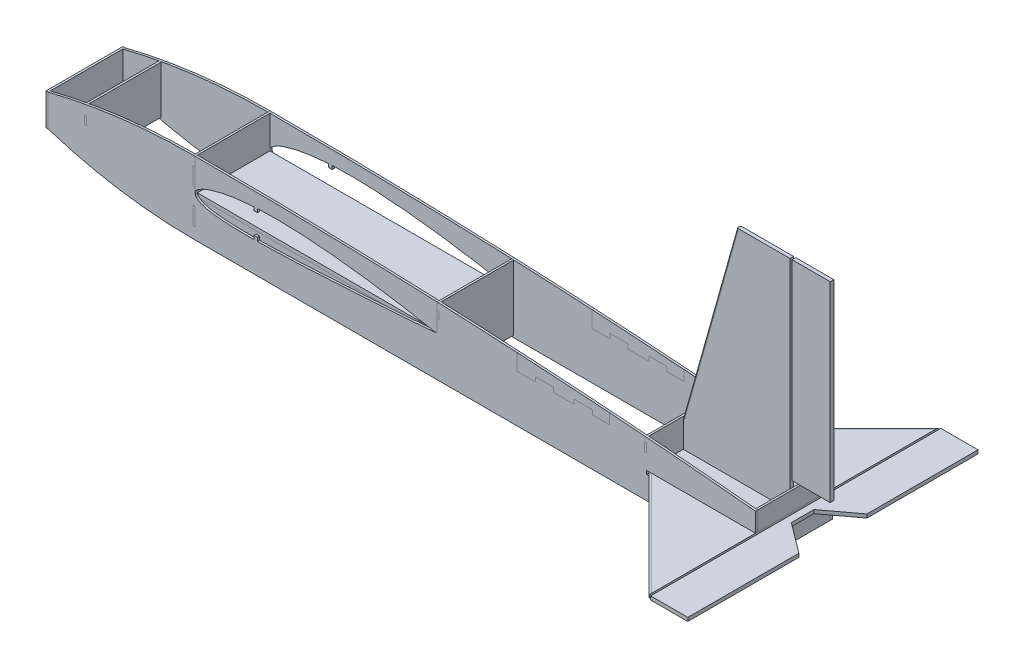
from build123d import *

# Parameters (mm, degrees)
BOSS_EXTRUDE4_DEPTH              = 3
BOSS_EXTRUDE5_DEPTH              = 3
BOSS_EXTRUDE6_DEPTH              = 2.8
BOSS_EXTRUDE7_DEPTH              = 2.8
BOSS_EXTRUDE8_DEPTH              = 2.8
SKETCH15_W                       = 101.6
SKETCH15_H                       = 63.5
BOSS_EXTRUDE9_DEPTH              = 2.8
BOSS_EXTRUDE10_DEPTH             = 3
CUT_EXTRUDE1_DEPTH               = 995.090061312
CUT_EXTRUDE1_DEPTH_BACK          = 995.090061312
SKETCH18_W                       = 152.4
SKETCH18_H                       = 5
SKETCH19_W                       = 149.6
SKETCH19_H                       = 11.952
BOSS_EXTRUDE12_DEPTH             = 10
BOSS_EXTRUDE12_2_DEPTH           = 10
BOSS_EXTRUDE13_DEPTH             = 5
SKETCH21_W                       = 139.7
SKETCH21_H                       = 12.7
BOSS_EXTRUDE14_DEPTH             = 10
BOSS_EXTRUDE14_2_DEPTH           = 10
CHAMFER1_SIZE                    = 76.2
CHAMFER1_SIZE2                   = 8.008942727
CHAMFER2_SIZE                    = 76.2
CHAMFER2_SIZE2                   = 8.008942727
CUT_EXTRUDE2_DEPTH               = 1013.71275419
CUT_EXTRUDE2_DEPTH_BACK          = 1013.71275419
SKETCH22_R                       = 1.27
SKETCH23_W                       = 406.4
SKETCH23_H                       = 5
BOSS_EXTRUDE15_DEPTH             = 52.07
CUT_EXTRUDE3_DEPTH               = 1067.751942393
CUT_EXTRUDE3_DEPTH_BACK          = 1067.751942393
SKETCH25_W                       = 127
SKETCH25_H                       = 5
BOSS_EXTRUDE16_REACH             = 1068.671
BOSS_EXTRUDE16_DIRECTION_2_REACH = 1068.671
BOSS_EXTRUDE17_REACH             = 1102.826
SKETCH27_W                       = 53.34
SKETCH27_H                       = 267.97
BOSS_EXTRUDE17_DIRECTION_2_REACH = 1102.826
CUT_EXTRUDE4_DEPTH               = 1101.826300603
CUT_EXTRUDE4_DEPTH_BACK          = 1101.826300603
BOSS_EXTRUDE19_DEPTH             = 3
CUT_EXTRUDE5_DEPTH               = 1108.917869971
CUT_EXTRUDE6_START               = -53.8
CUT_EXTRUDE6_DEPTH               = 107.6
BOSS_EXTRUDE21_DEPTH             = 3
SKETCH49_W                       = 107.6
SKETCH49_H                       = 44.75
BOSS_EXTRUDE23_DEPTH             = 3
FILLET1_R                        = 2.54
FILLET2_R                        = 2.54
EXTRUDE_THIN6_START              = -50.8
EXTRUDE_THIN6_OUTLINE_W          = 338.57
EXTRUDE_THIN6_OUTLINE_H          = 5
EXTRUDE_THIN6_DEPTH              = 101.6
SKETCH51_W                       = 338.57
SKETCH51_H                       = 47.88
BOSS_EXTRUDE24_DEPTH             = 10


# Read off the part's stored shape, not the designer's step: Cut-Extrude6, Extrude-Thin6
with BuildPart() as part:
    # Sketch7 → Boss-Extrude4 (new body)
    with BuildSketch(Plane.XY.offset(50.8)):
        with BuildLine():
            ThreePointArc((203.2, 38.1), (100.827823604, 31.801244765), (0, 13))
            Line((0, 13), (0, -31.75))
            ThreePointArc((0, -31.75), (100.367244397, -55.514635862), (203.2, -63.5))
            Line((203.2, -63.5), (990.6, -63.5))
            Line((990.6, -63.5), (990.6, 0))
            ThreePointArc((990.6, 0), (597.360617642, 28.56943127), (203.2, 38.1))
        make_face()
    extrude(amount=BOSS_EXTRUDE4_DEPTH)


with BuildPart() as body_2:
    # Sketch8 → Boss-Extrude5 (new body)
    with BuildSketch(Plane.XY.offset(-50.8)):
        with BuildLine():
            Line((990.6, -63.5), (990.6, 0))
            ThreePointArc((990.6, 0), (597.360617642, 28.56943127), (203.2, 38.1))
            ThreePointArc((203.2, 38.1), (100.827823604, 31.801244765), (0, 13))
            Line((0, 13), (0, -31.75))
            ThreePointArc((0, -31.75), (100.367244397, -55.514635862), (203.2, -63.5))
            Line((203.2, -63.5), (990.6, -63.5))
        make_face()
    extrude(amount=-BOSS_EXTRUDE5_DEPTH)


with BuildPart() as body_3:
    # Sketch12 → Boss-Extrude6 (new body)
    with BuildSketch(Plane(origin=(203.2, 0, 0), x_dir=(0, 0, -1), z_dir=(1, 0, 0))):
        Polygon((-50.8, 38.1), (50.8, 38.1), (50.8, 25.4), (53.8, 25.4), (53.8, 0), (50.8, 0), (50.8, -22.4), (53.8, -22.4), (53.8, -47.8), (50.8, -47.8), (50.8, -60.5), (-50.8, -60.5), (-50.8, -47.8), (-53.8, -47.8), (-53.8, -22.4), (-50.8, -22.4), (-50.8, 0), (-53.8, 0), (-53.8, 25.4), (-50.8, 25.4), align=None)
    extrude(amount=BOSS_EXTRUDE6_DEPTH)


with BuildPart() as body_4:
    # Sketch13 → Boss-Extrude7 (new body)
    with BuildSketch(Plane(origin=(547.37, 0, 0), x_dir=(0, 0, -1), z_dir=(1, 0, 0))):
        Polygon((-50.8, 30.834624953), (50.8, 30.834624953), (50.8, 20.636172415), (53.8, 20.636172415), (53.8, 10.476172415), (50.8, 10.476172415), (50.8, -31.602306054), (53.8, -31.602306054), (53.8, -41.762306054), (50.8, -41.762306054), (50.8, -60.5), (-50.8, -60.5), (-50.8, -41.762306054), (-53.8, -41.762306054), (-53.8, -31.602306054), (-50.8, -31.602306054), (-50.8, 10.476172415), (-53.8, 10.476172415), (-53.8, 20.636172415), (-50.8, 20.636172415), align=None)
    extrude(amount=-BOSS_EXTRUDE7_DEPTH)


with BuildPart() as body_5:
    # Sketch14 → Boss-Extrude8 (new body)
    with BuildSketch(Plane(origin=(838.2, 0, 0), x_dir=(0, 0, -1), z_dir=(1, 0, 0))):
        Polygon((-50.8, -60.5), (50.8, -60.5), (50.8, -57.15), (53.8, -57.15), (53.8, -44.45), (50.8, -44.45), (50.8, -5.708577763), (53.8, -5.708577763), (53.8, 6.991422237), (50.8, 6.991422237), (50.8, 13.341422237), (-50.8, 13.341422237), (-50.8, 6.991422237), (-53.8, 6.991422237), (-53.8, -5.708577763), (-50.8, -5.708577763), (-50.8, -41.45), (-53.8, -41.45), (-53.8, -54.15), (-50.8, -54.15), align=None)
    extrude(amount=-BOSS_EXTRUDE8_DEPTH)


with BuildPart() as body_6:
    # Sketch15 → Boss-Extrude9 (new body)
    with BuildSketch(Plane(origin=(990.6, 0, 0), x_dir=(0, 0, -1), z_dir=(1, 0, 0))):
        with Locations((0, -31.75)):
            Rectangle(SKETCH15_W, SKETCH15_H)
    extrude(amount=-BOSS_EXTRUDE9_DEPTH)


with BuildPart() as body_7:
    # Sketch16 → Boss-Extrude10 (new body)
    with BuildSketch(Plane(origin=(50.8, 0, 0), x_dir=(0, 0, -1), z_dir=(1, 0, 0))):
        Polygon((-50.8, 24.075673147), (50.8, 24.075673147), (50.8, 11.375673147), (53.8, 11.375673147), (53.8, -1.324326853), (50.8, -1.324326853), (50.8, -17.431939406), (53.8, -17.431939406), (53.8, -30.131939406), (50.8, -30.131939406), (50.8, -42.831939406), (-50.8, -42.831939406), (-50.8, -30.131939406), (-53.8, -30.131939406), (-53.8, -17.431939406), (-50.8, -17.431939406), (-50.8, -1.324326853), (-53.8, -1.324326853), (-53.8, 11.375673147), (-50.8, 11.375673147), align=None)
    extrude(amount=BOSS_EXTRUDE10_DEPTH)


with BuildPart() as cut_extrude1_tool:
    # Sketch18 → Cut-Extrude1 (new, two sides: drawn at the far end of the back side and taken through both)
    with BuildSketch(Plane.XY.offset(-CUT_EXTRUDE1_DEPTH_BACK)):
        with Locations((914.4, -29.25)):
            Rectangle(SKETCH18_W, SKETCH18_H)
    extrude(amount=CUT_EXTRUDE1_DEPTH + CUT_EXTRUDE1_DEPTH_BACK)


with BuildPart() as part_1:
    add(part.part)

    # Cut-Extrude1: cut by cut_extrude1_tool
    add(cut_extrude1_tool.part, mode=Mode.SUBTRACT)


with BuildPart() as body_2_1:
    add(body_2.part)

    # Cut-Extrude1: cut by cut_extrude1_tool
    add(cut_extrude1_tool.part, mode=Mode.SUBTRACT)


with BuildPart() as body_6_1:
    add(body_6.part)

    # Cut-Extrude1: cut by cut_extrude1_tool
    add(cut_extrude1_tool.part, mode=Mode.SUBTRACT)


with BuildPart() as body_8:
    # Sketch19 → Boss-Extrude12 (new body)
    with BuildSketch(Plane(origin=(0, -31.75, 0), x_dir=(1, 0, 0), z_dir=(0, 1, 0))):
        with Locations((913, -44.824)):
            Rectangle(SKETCH19_W, SKETCH19_H)
    extrude(amount=-BOSS_EXTRUDE12_DEPTH)


with BuildPart() as body_9:
    # Sketch19 → Boss-Extrude12 2 (new body)
    with BuildSketch(Plane(origin=(0, -31.75, 0), x_dir=(1, 0, 0), z_dir=(0, 1, 0))):
        with Locations((913, 44.824)):
            Rectangle(SKETCH19_W, SKETCH19_H)
    extrude(amount=-BOSS_EXTRUDE12_2_DEPTH)


with BuildPart() as body_10:
    # Sketch20 → Boss-Extrude13 (new body)
    with BuildSketch(Plane(origin=(0, -31.75, 0), x_dir=(1, 0, 0), z_dir=(0, 1, 0))):
        Polygon((838.2, 50.8), (838.2, -50.8), (990.6, -203.2), (990.6, 203.2), align=None)
    extrude(amount=BOSS_EXTRUDE13_DEPTH)


with BuildPart() as body_11:
    # Sketch21 → Boss-Extrude14 (new body)
    with BuildSketch(Plane(origin=(0, -26.75, 0), x_dir=(1, 0, 0), z_dir=(0, 1, 0))):
        with Locations((908.05, 44.45)):
            Rectangle(SKETCH21_W, SKETCH21_H)
    extrude(amount=BOSS_EXTRUDE14_DEPTH)

    # Chamfer1
    chamfer1_edges = [body_11.edges().sort_by_distance(p)[0] for p in [
        (977.9, -16.75, -44.45),
    ]]
    chamfer1_side = [body_11.faces().sort_by_distance(p)[0] for p in [
        (908.05, -16.75, -44.45),
    ]]
    chamfer(chamfer1_edges, length=CHAMFER1_SIZE, length2=CHAMFER1_SIZE2, reference=chamfer1_side[0])


with BuildPart() as body_12:
    # Sketch21 → Boss-Extrude14 2 (new body)
    with BuildSketch(Plane(origin=(0, -26.75, 0), x_dir=(1, 0, 0), z_dir=(0, 1, 0))):
        with Locations((908.05, -44.45)):
            Rectangle(SKETCH21_W, SKETCH21_H)
    extrude(amount=BOSS_EXTRUDE14_2_DEPTH)

    # Chamfer2
    chamfer2_edges = [body_12.edges().sort_by_distance(p)[0] for p in [
        (977.9, -16.75, 44.45),
    ]]
    chamfer2_side = [body_12.faces().sort_by_distance(p)[0] for p in [
        (908.05, -16.75, 44.45),
    ]]
    chamfer(chamfer2_edges, length=CHAMFER2_SIZE, length2=CHAMFER2_SIZE2, reference=chamfer2_side[0])


with BuildPart() as cut_extrude2_tool:
    # Sketch22 → Cut-Extrude2 (new, two sides: drawn at the far end of the back side and taken through both)
    with BuildSketch(Plane(origin=(0, -16.75, 0), x_dir=(1, 0, 0), z_dir=(0, 1, 0)).offset(-CUT_EXTRUDE2_DEPTH_BACK)):
        with Locations(Location((872.077439947, 45.6, 0), (0, 0, 270))):
            Circle(SKETCH22_R)
        with Locations(Location((935.482, 45.6, 0), (0, 0, 270))):
            Circle(SKETCH22_R)
        with Locations(Location((935.482, -45.6, 0), (0, 0, 180))):
            Circle(SKETCH22_R)
        with Locations(Location((872.077439947, -45.6, 0), (0, 0, 270))):
            Circle(SKETCH22_R)
    extrude(amount=CUT_EXTRUDE2_DEPTH + CUT_EXTRUDE2_DEPTH_BACK)


with BuildPart() as body_8_1:
    add(body_8.part)

    # Cut-Extrude2: cut by cut_extrude2_tool
    add(cut_extrude2_tool.part, mode=Mode.SUBTRACT)


with BuildPart() as body_9_1:
    add(body_9.part)

    # Cut-Extrude2: cut by cut_extrude2_tool
    add(cut_extrude2_tool.part, mode=Mode.SUBTRACT)


with BuildPart() as body_10_1:
    add(body_10.part)

    # Cut-Extrude2: cut by cut_extrude2_tool
    add(cut_extrude2_tool.part, mode=Mode.SUBTRACT)

    # Sketch25 → Cut-Extrude3 (cut, two sides: drawn at the far end of the back side and taken through both)
    with BuildSketch(Plane(origin=(0, -26.75, 0), x_dir=(1, 0, 0), z_dir=(0, 1, 0)).offset(-CUT_EXTRUDE3_DEPTH_BACK)):
        with Locations((901.7, 0)):
            Rectangle(SKETCH25_W, SKETCH25_H)
    extrude(amount=CUT_EXTRUDE3_DEPTH + CUT_EXTRUDE3_DEPTH_BACK, mode=Mode.SUBTRACT)


with BuildPart() as body_11_1:
    add(body_11.part)

    # Cut-Extrude2: cut by cut_extrude2_tool
    add(cut_extrude2_tool.part, mode=Mode.SUBTRACT)


with BuildPart() as body_12_1:
    add(body_12.part)

    # Cut-Extrude2: cut by cut_extrude2_tool
    add(cut_extrude2_tool.part, mode=Mode.SUBTRACT)


with BuildPart() as body_13:
    # Sketch23 → Boss-Extrude15 (new body)
    with BuildSketch(Plane(origin=(993.14, 0, 0), x_dir=(0, 0, -1), z_dir=(1, 0, 0))):
        with Locations((0, -29.25)):
            Rectangle(SKETCH23_W, SKETCH23_H)
    extrude(amount=BOSS_EXTRUDE15_DEPTH)

    # Sketch33 → Cut-Extrude5 (cut, through all)
    with BuildSketch(Plane(origin=(0, -26.75, 0), x_dir=(1, 0, 0), z_dir=(0, 1, 0))):
        Polygon((1045.21, 47.658624954), (1002.753513304, 15.875), (1002.753513304, -15.875), (1045.21, -47.658624954), align=None)
    extrude(amount=-CUT_EXTRUDE5_DEPTH, mode=Mode.SUBTRACT)


with BuildPart() as body_14:

    # Boss-Extrude16: up to this face of the body (flat: up to its plane)
    boss_extrude16_end = Plane(body_10_1.part.faces().sort_by_distance((901.7, -29.25, -2.5))[0])
    # Sketch26 → Boss-Extrude16 (new, up to the picked face)
    with BuildSketch(Plane.XY, mode=Mode.PRIVATE) as boss_extrude16_sk1:
        Polygon((838.2, 13.341422237), (838.2, -60.5), (987.8, -60.5), (987.8, 279.4), (912.999999994, 279.4), align=None)
    boss_extrude16_tool1 = split(extrude(boss_extrude16_sk1.sketch, amount=-BOSS_EXTRUDE16_REACH, mode=Mode.PRIVATE), bisect_by=boss_extrude16_end, keep=Keep.BOTH, mode=Mode.PRIVATE)
    add(boss_extrude16_tool1.solids().sort_by(Axis((925.132558, 89.678519, 0), (0, 0, -1)))[0])


    # Boss-Extrude16 direction 2: up to this face of the body (flat: up to its plane)
    boss_extrude16_direction_2_end = Plane(body_10_1.part.faces().sort_by_distance((901.7, -29.25, 2.5))[0])
    # Sketch26 → Boss-Extrude16 direction 2 (add, up to the picked face)
    with BuildSketch(Plane.XY, mode=Mode.PRIVATE) as boss_extrude16_direction_2_sk1:
        Polygon((838.2, 13.341422237), (838.2, -60.5), (987.8, -60.5), (987.8, 279.4), (912.999999994, 279.4), align=None)
    boss_extrude16_direction_2_tool1 = split(extrude(boss_extrude16_direction_2_sk1.sketch, amount=BOSS_EXTRUDE16_DIRECTION_2_REACH, mode=Mode.PRIVATE), bisect_by=boss_extrude16_direction_2_end, keep=Keep.BOTH, mode=Mode.PRIVATE)
    add(boss_extrude16_direction_2_tool1.solids().sort_by(Axis((925.132558, 89.678519, 0), (0, 0, 1)))[0])


with BuildPart() as body_15:

    # Boss-Extrude17: up to this face of the body (flat: up to its plane)
    boss_extrude17_end = Plane(body_14.part.faces().sort_by_distance((925.132557707, 89.678519394, 2.5))[0])
    # Sketch27 → Boss-Extrude17 (new, up to the picked face)
    with BuildSketch(Plane.XY, mode=Mode.PRIVATE) as boss_extrude17_sk1:
        with Locations((1017.27, 145.415)):
            Rectangle(SKETCH27_W, SKETCH27_H)
    boss_extrude17_tool1 = split(extrude(boss_extrude17_sk1.sketch, amount=BOSS_EXTRUDE17_REACH, mode=Mode.PRIVATE), bisect_by=boss_extrude17_end, keep=Keep.BOTH, mode=Mode.PRIVATE)
    add(boss_extrude17_tool1.solids().sort_by(Axis((1017.27, 145.415, 0), (0, 0, 1)))[0])


    # Boss-Extrude17 direction 2: up to this face of the body (flat: up to its plane)
    boss_extrude17_direction_2_end = Plane(body_14.part.faces().sort_by_distance((925.132557707, 89.678519394, -2.5))[0])
    # Sketch27 → Boss-Extrude17 direction 2 (add, up to the picked face)
    with BuildSketch(Plane.XY, mode=Mode.PRIVATE) as boss_extrude17_direction_2_sk1:
        with Locations((1017.27, 145.415)):
            Rectangle(SKETCH27_W, SKETCH27_H)
    boss_extrude17_direction_2_tool1 = split(extrude(boss_extrude17_direction_2_sk1.sketch, amount=-BOSS_EXTRUDE17_DIRECTION_2_REACH, mode=Mode.PRIVATE), bisect_by=boss_extrude17_direction_2_end, keep=Keep.BOTH, mode=Mode.PRIVATE)
    add(boss_extrude17_direction_2_tool1.solids().sort_by(Axis((1017.27, 145.415, 0), (0, 0, -1)))[0])


with BuildPart() as cut_extrude4_tool:
    # Sketch30 → Cut-Extrude4 (new, two sides: drawn at the far end of the back side and taken through both)
    with BuildSketch(Plane.XY.offset(-CUT_EXTRUDE4_DEPTH_BACK)):
        with BuildLine():
            Line((656.939023384, 2.617617228), (682.339023384, 2.617617228))
            Line((682.339023384, 2.617617228), (682.339023384, 8.967617228))
            Line((682.339023384, 8.967617228), (707.739023384, 8.967617228))
            Line((707.739023384, 8.967617228), (707.739023384, 2.617617228))
            Line((707.739023384, 2.617617228), (736.6, 2.617617228))
            Line((736.6, 2.617617228), (736.6, 8.967617228))
            Line((736.6, 8.967617228), (762, 8.967617228))
            Line((762, 8.967617228), (762, 2.617617228))
            Line((762, 2.617617228), (786.206150196, 2.617617228))
            Line((786.206150196, 2.617617228), (786.206150196, 17.234888816))
            ThreePointArc((786.206150196, 17.234888816), (721.588932509, 21.608152987), (656.939023384, 25.468141492))
            Line((656.939023384, 25.468141492), (656.939023384, 2.617617228))
        make_face()
    extrude(amount=CUT_EXTRUDE4_DEPTH + CUT_EXTRUDE4_DEPTH_BACK)


with BuildPart() as part_2:
    add(part_1.part)

    # Cut-Extrude4: cut by cut_extrude4_tool
    add(cut_extrude4_tool.part, mode=Mode.SUBTRACT)


with BuildPart() as body_2_2:
    add(body_2_1.part)

    # Cut-Extrude4: cut by cut_extrude4_tool
    add(cut_extrude4_tool.part, mode=Mode.SUBTRACT)


with BuildPart() as body_16:
    # Sketch32 → Boss-Extrude19 (new body)
    with BuildSketch(Plane.XY.offset(50.8)):
        with BuildLine():
            Line((762, 8.967617228), (762, 2.617617228))
            Line((762, 2.617617228), (786.206150196, 2.617617228))
            Line((786.206150196, 2.617617228), (786.206150196, 17.234888816))
            ThreePointArc((786.206150196, 17.234888816), (721.588928501, 21.608090064), (656.939023384, 25.468141492))
            Line((656.939023384, 25.468141492), (656.939023384, 2.617617228))
            Line((656.939023384, 2.617617228), (682.339023384, 2.617617228))
            Line((682.339023384, 2.617617228), (682.339023384, 8.967617228))
            Line((682.339023384, 8.967617228), (707.739023384, 8.967617228))
            Line((707.739023384, 8.967617228), (707.739023384, 2.617617228))
            Line((707.739023384, 2.617617228), (736.6, 2.617617228))
            Line((736.6, 2.617617228), (736.6, 8.967617228))
            Line((736.6, 8.967617228), (762, 8.967617228))
        make_face()
    extrude(amount=BOSS_EXTRUDE19_DEPTH)


with BuildPart() as cut_extrude6_tool:
    # Cut-Extrude6 outline → Cut-Extrude6 (new body)
    with BuildSketch(Plane.XY.offset(CUT_EXTRUDE6_START)):
        with BuildLine():
            Line((206, 38.099519344), (206, -7.62))
            add(Edge.make_bspline(
                [(206, -7.62), (206.226545056, -9.759348592), (209.484172125, -13.160140385), (213.460827525, -14.90791796), (215.45485252, -15.629098382), (215.999999998, -15.816240432)],
                knots=[0.503458853, 0.503458853, 0.503458853, 0.503458853, 0.513609129, 0.520450991, 0.522992759, 0.522992759, 0.522992759, 0.522992759], degree=3))
            add(Edge.make_bspline(
                [(215.999999998, -15.816240432), (218.196794439, -16.570371434), (223.245696392, -17.946271057), (231.100617306, -19.299173831), (242.294284523, -20.537477836), (256.266698732, -21.490584395), (272.489945349, -21.860094186), (283.112637443, -21.84001945), (288.14550001, -21.786095302)],
                knots=[0.522992759, 0.522992759, 0.522992759, 0.522992759, 0.533235388, 0.545691039, 0.558031884, 0.582609167, 0.607134742, 0.629220983, 0.629220983, 0.629220983, 0.629220983], degree=3))
            Line((288.14550001, -21.786095302), (288.1455, -16.544172161))
            Line((288.1455, -16.544172161), (293.1455, -16.544172161))
            Line((293.1455, -16.544172161), (293.1455, -21.718551))
            add(Edge.make_bspline(
                [(293.1455, -21.718551), (297.620369049, -21.646328126), (313.27225525, -21.290764851), (340.100983831, -20.438337908), (373.626044522, -18.893353914), (407.141383972, -16.885258558), (464.148400507, -13.335601373), (509.980400472, -10.411292189), (544.57, -7.180649593)],
                knots=[0.636535264, 0.636535264, 0.636535264, 0.636535264, 0.656174272, 0.705233949, 0.754320379, 0.803437364, 0.852566096, 1.004960967, 1.004960967, 1.004960967, 1.004960967], degree=3))
            Line((544.57, -7.180649593), (544.57, 30.952410847))
            ThreePointArc((544.57, 30.952410847), (375.3221006, 36.283480062), (206, 38.099519344))
        make_face()
    extrude(amount=CUT_EXTRUDE6_DEPTH)


with BuildPart() as part_3:
    add(part_2.part)

    # Cut-Extrude6: cut by cut_extrude6_tool
    add(cut_extrude6_tool.part, mode=Mode.SUBTRACT)


with BuildPart() as body_2_3:
    add(body_2_2.part)

    # Cut-Extrude6: cut by cut_extrude6_tool
    add(cut_extrude6_tool.part, mode=Mode.SUBTRACT)


with BuildPart() as body_17:
    # Sketch43 → Boss-Extrude21 (new body)
    with BuildSketch(Plane.XY.offset(50.8)):
        with BuildLine():
            Line((293.1455, 13.282930222), (293.1455, 18.282930222))
            add(Edge.make_bspline(
                [(544.57, -7.583661124), (510.133407247, -0.662779232), (464.3800694, 7.044375921), (407.190345957, 13.874080318), (373.652012091, 16.805484843), (340.121316052, 18.790622057), (313.260761198, 19.113252423), (297.617066259, 18.521220762), (293.145500001, 18.282930222)],
                knots=[-0.004900136, -0.004900136, -0.004900136, -0.004900136, 0.14920632, 0.198581097, 0.24780517, 0.296916575, 0.345952722, 0.3656013, 0.3656013, 0.3656013, 0.3656013], degree=3))
            Line((544.57, -7.583661124), (544.57, 30.952410847))
            ThreePointArc((544.57, 30.952410847), (375.3221006, 36.283480062), (206, 38.099519344))
            Line((206, 38.099519344), (206, -3.912282861))
            add(Edge.make_bspline(
                [(288.1455, 17.987374349), (283.104872995, 17.659718215), (272.453791451, 16.774335071), (256.200804275, 14.696949969), (242.215891962, 12.052120912), (231.066845415, 9.059883486), (219.034106276, 5.187242282), (210.043027916, 0.504226355), (206, -3.912282861)],
                knots=[0.372927197, 0.372927197, 0.372927197, 0.372927197, 0.395091204, 0.419814796, 0.444798575, 0.457489819, 0.470406405, 0.5004326, 0.5004326, 0.5004326, 0.5004326], degree=3))
            Line((288.1455, 17.987374349), (288.1455, 13.282930222))
            Line((288.1455, 13.282930222), (293.1455, 13.282930222))
        make_face()
    extrude(amount=BOSS_EXTRUDE21_DEPTH)


with BuildPart() as body_18:
    # Sketch49 → Boss-Extrude23 (new body)
    with BuildSketch(Plane.ZY):
        with Locations((0, -9.375)):
            Rectangle(SKETCH49_W, SKETCH49_H)
    extrude(amount=BOSS_EXTRUDE23_DEPTH)


with BuildPart() as body_19:
    # Mirror1: mirrored copy
    add(body_17.part.mirror(Plane.XY))


with BuildPart() as body_20:
    # Mirror1 2: mirrored copy
    add(body_16.part.mirror(Plane.XY))


with BuildPart() as body_10_2:
    add(body_10_1.part)

    # Fillet1
    # the kernel refuses this fillet: 2.54 mm, written as the material it takes off along each edge
    with BuildSketch(Plane(origin=(995.090128061, -31.75, -207.690128061), x_dir=(0.7071067811865472, 0, 0.7071067811865478), z_dir=(-0.7071067811865478, 0, 0.7071067811865474)), Plane(origin=(833.709871939, -31.75, 46.309871939), x_dir=(0.7071067811865472, 0, -0.7071067811865478), z_dir=(0.7071067811865478, 0, 0.7071067811865474))) as fillet1_piece_1:
        with BuildLine():
            CenterArc((FILLET1_R, FILLET1_R), FILLET1_R, 180, 90)
            Line((0, FILLET1_R), (0, 0))
            Line((0, 0), (FILLET1_R, 0))
        make_face()
    extrude(amount=228.226146906, mode=Mode.SUBTRACT)
    with BuildSketch(Plane(origin=(995.090128061, -26.75, -207.690128061), x_dir=(0.7071067811865472, 0, 0.7071067811865478), z_dir=(-0.7071067811865478, 0, 0.7071067811865474)), Plane(origin=(833.709871939, -26.75, 46.309871939), x_dir=(0.7071067811865472, 0, -0.7071067811865478), z_dir=(0.7071067811865478, 0, 0.7071067811865474))) as fillet1_piece_2:
        with BuildLine():
            CenterArc((FILLET1_R, -FILLET1_R), FILLET1_R, 90, 90)
            Line((0, -FILLET1_R), (0, 0))
            Line((0, 0), (FILLET1_R, 0))
        make_face()
    extrude(amount=228.226146906, mode=Mode.SUBTRACT)


with BuildPart() as body_14_1:
    add(body_14.part)

    # Fillet2
    # the kernel refuses this fillet: 2.54 mm, written as the material it takes off along each edge
    with BuildSketch(Plane(origin=(834.075318071, -1.329794446, -2.5), x_dir=(0.9626782600882348, -0.2706484205634479, 0), z_dir=(0.27064842056344796, 0.9626782600882349, 0)), Plane(origin=(834.075318071, -1.329794446, 2.5), x_dir=(0, 0, -1), z_dir=(0.27064842056344796, 0.9626782600882349, 0))) as fillet2_piece_1:
        with BuildLine():
            CenterArc((FILLET2_R, -FILLET2_R), FILLET2_R, 90, 90)
            Line((0, -FILLET2_R), (-FILLET2_R * 0.02, -FILLET2_R))
            Line((-FILLET2_R * 0.02, -FILLET2_R), (-FILLET2_R * 0.02, FILLET2_R * 0.02))
            Line((-FILLET2_R * 0.02, FILLET2_R * 0.02), (FILLET2_R, FILLET2_R * 0.02))
            Line((FILLET2_R, FILLET2_R * 0.02), (FILLET2_R, 0))
        make_face()
    extrude(amount=306.853310579, mode=Mode.SUBTRACT)


with BuildPart() as body_21:
    # Extrude-Thin6 outline → Extrude-Thin6 (new body)
    with BuildSketch(Plane.XY.offset(EXTRUDE_THIN6_START)):
        with Locations((375.285, -10.12)):
            Rectangle(EXTRUDE_THIN6_OUTLINE_W, EXTRUDE_THIN6_OUTLINE_H)
    extrude(amount=EXTRUDE_THIN6_DEPTH)


with BuildPart() as body_22:
    # Sketch51 → Boss-Extrude24 (new body)
    with BuildSketch(Plane.XY.offset(-50.8)):
        with Locations((375.285, -36.56)):
            Rectangle(SKETCH51_W, SKETCH51_H)
    extrude(amount=BOSS_EXTRUDE24_DEPTH)


with BuildPart() as body_23:
    # Mirror2: mirrored copy
    add(body_22.part.mirror(Plane.XY))


solid = Compound([body_3.part, body_4.part, body_5.part, body_7.part, body_6_1.part, body_8_1.part, body_9_1.part, body_11_1.part, body_12_1.part, body_13.part, body_15.part, body_16.part, part_3.part, body_2_3.part, body_17.part, body_18.part, body_19.part, body_20.part, body_10_2.part, body_14_1.part, body_21.part, body_22.part, body_23.part])
